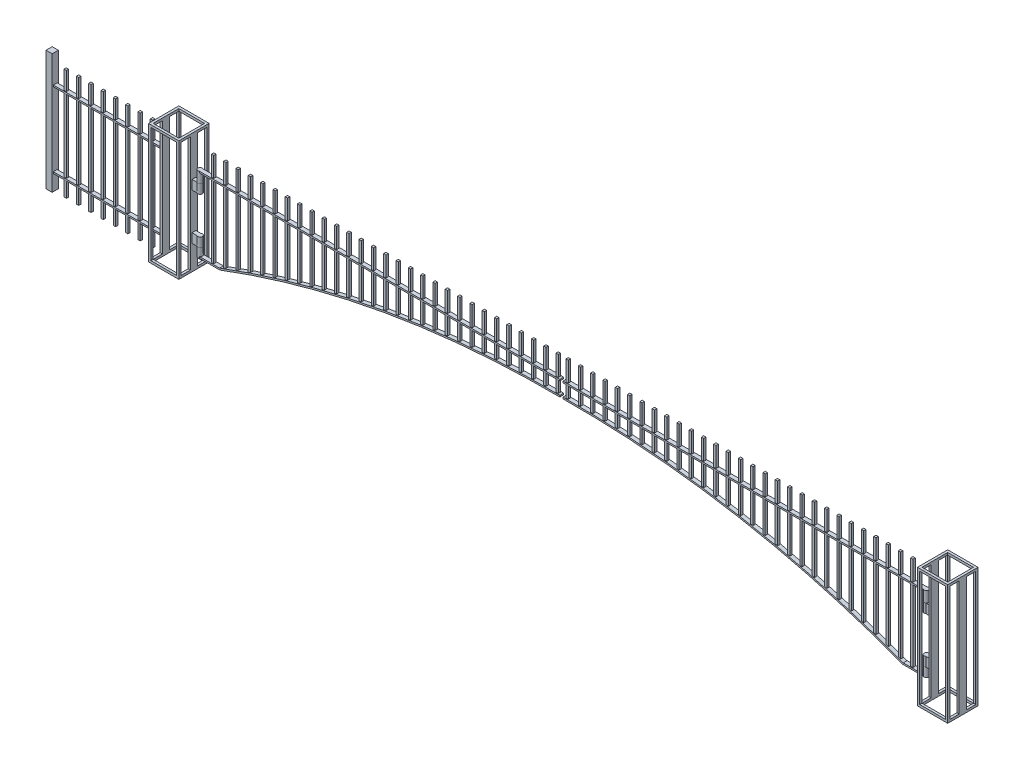
from build123d import *

# Parameters (mm, degrees)
SKETCH1_W                 = 19.05
SKETCH1_H                 = 60
BOSS_EXTRUDE1_DEPTH       = 990.6
SKETCH1_H_2               = 19.05
BOSS_EXTRUDE1_2_DEPTH     = 990.6
BOSS_EXTRUDE1_3_DEPTH     = 990.6
BOSS_EXTRUDE1_4_DEPTH     = 990.6
BOSS_EXTRUDE1_5_DEPTH     = 990.6
BOSS_EXTRUDE1_6_DEPTH     = 990.6
SKETCH1_W_2               = 50.8
SKETCH1_H_3               = 50.8
BOSS_EXTRUDE1_7_DEPTH     = 990.6
BOSS_EXTRUDE2_START       = 971.55
BOSS_EXTRUDE2_OUTLINE_W   = 211.9
BOSS_EXTRUDE2_OUTLINE_H   = 19.05
BOSS_EXTRUDE2_OUTLINE_W_2 = 19.05
BOSS_EXTRUDE2_OUTLINE_H_2 = 75.95
BOSS_EXTRUDE2_DEPTH       = 19.05
SKETCH1_4_W               = 19.05
SKETCH1_4_H               = 75.95
SKETCH1_4_W_2             = 211.9
SKETCH1_4_H_2             = 19.05
BOSS_EXTRUDE3_DEPTH       = 19.05
SKETCH1_5_W               = 19.05
SKETCH1_5_H               = 19.05
BOSS_EXTRUDE4_DEPTH       = 914.4
BOSS_EXTRUDE4_2_DEPTH     = 914.4
BOSS_EXTRUDE4_3_DEPTH     = 914.4
BOSS_EXTRUDE4_4_DEPTH     = 914.4
BOSS_EXTRUDE4_5_DEPTH     = 914.4
BOSS_EXTRUDE4_6_DEPTH     = 914.4
BOSS_EXTRUDE4_7_DEPTH     = 914.4
BOSS_EXTRUDE4_8_DEPTH     = 914.4
BOSS_EXTRUDE5_START       = 130
SKETCH2_W                 = 895.35
SKETCH2_H                 = 31.75
BOSS_EXTRUDE5_DEPTH       = 12.7
BOSS_EXTRUDE6_START       = 750
SKETCH2_2_W               = 895.35
SKETCH2_2_H               = 31.75
BOSS_EXTRUDE6_DEPTH       = 12.7
BOSS_EXTRUDE7_START       = -406.4
BOSS_EXTRUDE7_DEPTH       = 76.2
BOSS_EXTRUDE11_START      = -787.4
BOSS_EXTRUDE11_DEPTH      = 76.2
BOSS_EXTRUDE8_START       = -330.2
SKETCH5_3_R               = 19.05
BOSS_EXTRUDE8_DEPTH       = 76.2
BOSS_EXTRUDE12_START      = -787.4
SKETCH5_7_R               = 19.05
BOSS_EXTRUDE12_DEPTH      = 76.2
BOSS_EXTRUDE9_START       = -254
SKETCH5_4_W               = 19.05
SKETCH5_4_H               = 19.05
BOSS_EXTRUDE9_DEPTH       = 12.7
EXTRUDE_THIN1_START       = -15.875
EXTRUDE_THIN1_DEPTH       = 31.75
BOSS_EXTRUDE10_START      = -76.2
SKETCH5_5_W               = 19.05
SKETCH5_5_H               = 19.05
BOSS_EXTRUDE10_DEPTH      = 914.4
CUT_EXTRUDE1_DEPTH        = 4361.014057603
CUT_EXTRUDE1_DEPTH_BACK   = 4361.014057603


# Read off the part's stored shape, not the designer's step: Boss-Extrude2, Extrude-Thin1
with BuildPart() as part:
    # Sketch1 → Boss-Extrude1 (new body)
    with BuildSketch(Plane(origin=(0, 0, 0), x_dir=(1, 0, 0), z_dir=(0, 1, 0))):
        with Locations((-3288.475, 0)):
            Rectangle(SKETCH1_W, SKETCH1_H)
    extrude(amount=BOSS_EXTRUDE1_DEPTH)



with BuildPart() as body_2:
    # Sketch1 → Boss-Extrude1 2 (new body)
    with BuildSketch(Plane(origin=(0, 0, 0), x_dir=(1, 0, 0), z_dir=(0, 1, 0))):
        with Locations((-3288.475, 115.475)):
            Rectangle(SKETCH1_W, SKETCH1_H_2)
    extrude(amount=BOSS_EXTRUDE1_2_DEPTH)


with BuildPart() as body_3:
    # Sketch1 → Boss-Extrude1 3 (new body)
    with BuildSketch(Plane(origin=(0, 0, 0), x_dir=(1, 0, 0), z_dir=(0, 1, 0))):
        with Locations((-3288.475, -115.475)):
            Rectangle(SKETCH1_W, SKETCH1_H_2)
    extrude(amount=BOSS_EXTRUDE1_3_DEPTH)


with BuildPart() as body_4:
    # Sketch1 → Boss-Extrude1 4 (new body)
    with BuildSketch(Plane(origin=(0, 0, 0), x_dir=(1, 0, 0), z_dir=(0, 1, 0))):
        with Locations((-3057.525, 115.475)):
            Rectangle(SKETCH1_W, SKETCH1_H_2)
    extrude(amount=BOSS_EXTRUDE1_4_DEPTH)


with BuildPart() as body_5:
    # Sketch1 → Boss-Extrude1 5 (new body)
    with BuildSketch(Plane(origin=(0, 0, 0), x_dir=(1, 0, 0), z_dir=(0, 1, 0))):
        with Locations((-3057.525, 0)):
            Rectangle(SKETCH1_W, SKETCH1_H)
    extrude(amount=BOSS_EXTRUDE1_5_DEPTH)


with BuildPart() as body_6:
    # Sketch1 → Boss-Extrude1 6 (new body)
    with BuildSketch(Plane(origin=(0, 0, 0), x_dir=(1, 0, 0), z_dir=(0, 1, 0))):
        with Locations((-3057.525, -115.475)):
            Rectangle(SKETCH1_W, SKETCH1_H_2)
    extrude(amount=BOSS_EXTRUDE1_6_DEPTH)


with BuildPart() as body_7:
    # Sketch1 → Boss-Extrude1 7 (new body)
    with BuildSketch(Plane(origin=(0, 0, 0), x_dir=(1, 0, 0), z_dir=(0, 1, 0))):
        with Locations((-4218.75, 0)):
            Rectangle(SKETCH1_W_2, SKETCH1_H_3)
    extrude(amount=BOSS_EXTRUDE1_7_DEPTH)


with BuildPart() as part_1:
    add(part.part)

    add(body_2.part)  # Boss-Extrude2 merges body 2

    add(body_3.part)  # Boss-Extrude2 merges body 3

    add(body_4.part)  # Boss-Extrude2 merges body 4

    add(body_5.part)  # Boss-Extrude2 merges body 5

    add(body_6.part)  # Boss-Extrude2 merges body 6
    # Boss-Extrude2 outline → Boss-Extrude2 (add)
    with BuildSketch(Plane(origin=(0, 0, 0), x_dir=(1, 0, 0), z_dir=(0, 1, 0)).offset(BOSS_EXTRUDE2_START)):
        with Locations((-3173, 115.475)):
            Rectangle(BOSS_EXTRUDE2_OUTLINE_W, BOSS_EXTRUDE2_OUTLINE_H)
        with Locations((-3288.475, 67.975)):
            Rectangle(BOSS_EXTRUDE2_OUTLINE_W_2, BOSS_EXTRUDE2_OUTLINE_H_2)
        with Locations((-3057.525, 67.975)):
            Rectangle(BOSS_EXTRUDE2_OUTLINE_W_2, BOSS_EXTRUDE2_OUTLINE_H_2)
        with Locations((-3288.475, -67.975)):
            Rectangle(BOSS_EXTRUDE2_OUTLINE_W_2, BOSS_EXTRUDE2_OUTLINE_H_2)
        with Locations((-3057.525, -67.975)):
            Rectangle(BOSS_EXTRUDE2_OUTLINE_W_2, BOSS_EXTRUDE2_OUTLINE_H_2)
        with Locations((-3173, -115.475)):
            Rectangle(BOSS_EXTRUDE2_OUTLINE_W, BOSS_EXTRUDE2_OUTLINE_H)
    extrude(amount=BOSS_EXTRUDE2_DEPTH)

    # Sketch1<4> → Boss-Extrude3 (add)
    with BuildSketch(Plane(origin=(0, 0, 0), x_dir=(1, 0, 0), z_dir=(0, 1, 0))):
        with Locations((-3288.475, 67.975)):
            Rectangle(SKETCH1_4_W, SKETCH1_4_H)
        with Locations((-3288.475, -67.975)):
            Rectangle(SKETCH1_4_W, SKETCH1_4_H)
        with Locations((-3173, 115.475)):
            Rectangle(SKETCH1_4_W_2, SKETCH1_4_H_2)
        with Locations((-3057.525, 67.975)):
            Rectangle(SKETCH1_4_W, SKETCH1_4_H)
        with Locations((-3173, -115.475)):
            Rectangle(SKETCH1_4_W_2, SKETCH1_4_H_2)
        with Locations((-3057.525, -67.975)):
            Rectangle(SKETCH1_4_W, SKETCH1_4_H)
    extrude(amount=BOSS_EXTRUDE3_DEPTH)

    # Sketch5 → Boss-Extrude7 (add)
    with BuildSketch(Plane(origin=(0, 990.6, 0), x_dir=(1, 0, 0), z_dir=(0, 1, 0)).offset(BOSS_EXTRUDE7_START)):
        with BuildLine():
            Line((-3007.730283709, 15.875), (-3048, 15.875))
            Line((-3048, 15.875), (-3048, -15.875))
            Line((-3048, -15.875), (-3007.730283709, -15.875))
            ThreePointArc((-3007.730283709, -15.875), (-2978.15, 0), (-3007.730283709, 15.875))
        make_face()
    extrude(amount=BOSS_EXTRUDE7_DEPTH)

    # Sketch5<6> → Boss-Extrude11 (add)
    with BuildSketch(Plane(origin=(0, 990.6, 0), x_dir=(1, 0, 0), z_dir=(0, 1, 0)).offset(BOSS_EXTRUDE11_START)):
        with BuildLine():
            Line((-3007.730283709, 15.875), (-3048, 15.875))
            Line((-3048, 15.875), (-3048, -15.875))
            Line((-3048, -15.875), (-3007.730283709, -15.875))
            ThreePointArc((-3007.730283709, -15.875), (-2978.15, 0), (-3007.730283709, 15.875))
        make_face()
    extrude(amount=BOSS_EXTRUDE11_DEPTH)


with BuildPart() as body_3_2:
    # Sketch1<5> → Boss-Extrude4 (new body)
    with BuildSketch(Plane(origin=(0, 0, 0), x_dir=(1, 0, 0), z_dir=(0, 1, 0))):
        with Locations((-3491.675, 0)):
            Rectangle(SKETCH1_5_W, SKETCH1_5_H)
    extrude(amount=BOSS_EXTRUDE4_DEPTH)


with BuildPart() as body_4_2:
    # Sketch1<5> → Boss-Extrude4 2 (new body)
    with BuildSketch(Plane(origin=(0, 0, 0), x_dir=(1, 0, 0), z_dir=(0, 1, 0))):
        with Locations((-3390.075, 0)):
            Rectangle(SKETCH1_5_W, SKETCH1_5_H)
    extrude(amount=BOSS_EXTRUDE4_2_DEPTH)


    add(body_3_2.part)  # Boss-Extrude5 merges body 3 2


with BuildPart() as body_5_2:
    # Sketch1<5> → Boss-Extrude4 3 (new body)
    with BuildSketch(Plane(origin=(0, 0, 0), x_dir=(1, 0, 0), z_dir=(0, 1, 0))):
        with Locations((-3593.275, 0)):
            Rectangle(SKETCH1_5_W, SKETCH1_5_H)
    extrude(amount=BOSS_EXTRUDE4_3_DEPTH)


with BuildPart() as body_6_2:
    # Sketch1<5> → Boss-Extrude4 4 (new body)
    with BuildSketch(Plane(origin=(0, 0, 0), x_dir=(1, 0, 0), z_dir=(0, 1, 0))):
        with Locations((-3694.875, 0)):
            Rectangle(SKETCH1_5_W, SKETCH1_5_H)
    extrude(amount=BOSS_EXTRUDE4_4_DEPTH)


with BuildPart() as body_7_2:
    # Sketch1<5> → Boss-Extrude4 5 (new body)
    with BuildSketch(Plane(origin=(0, 0, 0), x_dir=(1, 0, 0), z_dir=(0, 1, 0))):
        with Locations((-3796.475, 0)):
            Rectangle(SKETCH1_5_W, SKETCH1_5_H)
    extrude(amount=BOSS_EXTRUDE4_5_DEPTH)


with BuildPart() as body_8:
    # Sketch1<5> → Boss-Extrude4 6 (new body)
    with BuildSketch(Plane(origin=(0, 0, 0), x_dir=(1, 0, 0), z_dir=(0, 1, 0))):
        with Locations((-3898.075, 0)):
            Rectangle(SKETCH1_5_W, SKETCH1_5_H)
    extrude(amount=BOSS_EXTRUDE4_6_DEPTH)


with BuildPart() as body_9:
    # Sketch1<5> → Boss-Extrude4 7 (new body)
    with BuildSketch(Plane(origin=(0, 0, 0), x_dir=(1, 0, 0), z_dir=(0, 1, 0))):
        with Locations((-3999.675, 0)):
            Rectangle(SKETCH1_5_W, SKETCH1_5_H)
    extrude(amount=BOSS_EXTRUDE4_7_DEPTH)


with BuildPart() as body_10:
    # Sketch1<5> → Boss-Extrude4 8 (new body)
    with BuildSketch(Plane(origin=(0, 0, 0), x_dir=(1, 0, 0), z_dir=(0, 1, 0))):
        with Locations((-4101.275, 0)):
            Rectangle(SKETCH1_5_W, SKETCH1_5_H)
    extrude(amount=BOSS_EXTRUDE4_8_DEPTH)


with BuildPart() as body_4_2_1:
    add(body_4_2.part)

    add(body_5_2.part)  # Boss-Extrude5 merges body 5 2

    add(body_6_2.part)  # Boss-Extrude5 merges body 6 2

    add(body_7_2.part)  # Boss-Extrude5 merges body 7 2

    add(body_8.part)  # Boss-Extrude5 merges body 8

    add(body_9.part)  # Boss-Extrude5 merges body 9

    add(body_10.part)  # Boss-Extrude5 merges body 10

    add(body_7.part)  # Boss-Extrude5 merges body 7
    # Sketch2 → Boss-Extrude5 (add)
    with BuildSketch(Plane(origin=(0, 0, 0), x_dir=(1, 0, 0), z_dir=(0, 1, 0)).offset(BOSS_EXTRUDE5_START)):
        with Locations((-3745.675, 0)):
            Rectangle(SKETCH2_W, SKETCH2_H)
    extrude(amount=BOSS_EXTRUDE5_DEPTH)

    # Sketch2<2> → Boss-Extrude6 (add)
    with BuildSketch(Plane(origin=(0, 0, 0), x_dir=(1, 0, 0), z_dir=(0, 1, 0)).offset(BOSS_EXTRUDE6_START)):
        with Locations((-3745.675, 0)):
            Rectangle(SKETCH2_2_W, SKETCH2_2_H)
    extrude(amount=BOSS_EXTRUDE6_DEPTH)


with BuildPart() as body_3_3:
    # Sketch5<3> → Boss-Extrude8 (new body)
    with BuildSketch(Plane(origin=(0, 990.6, 0), x_dir=(1, 0, 0), z_dir=(0, 1, 0)).offset(BOSS_EXTRUDE8_START)):
        with Locations(Location((-2997.2, 0, 0), (0, 0, 90))):
            Circle(SKETCH5_3_R)
    extrude(amount=BOSS_EXTRUDE8_DEPTH)

    # Sketch5<4> → Boss-Extrude9 (add)
    with BuildSketch(Plane(origin=(0, 990.6, 0), x_dir=(1, 0, 0), z_dir=(0, 1, 0)).offset(BOSS_EXTRUDE9_START)):
        with BuildLine():
            ThreePointArc((-2986.669716291, 15.875), (-3016.25, 0), (-2986.669716291, -15.875))
            Line((-2986.669716291, -15.875), (-12.7, -15.875))
            Line((-12.7, -15.875), (-12.7, 15.875))
            Line((-12.7, 15.875), (-2986.669716291, 15.875))
        make_face()
        with Locations((-41.275, 0)):
            Rectangle(SKETCH5_4_W, SKETCH5_4_H, mode=Mode.SUBTRACT)
        with Locations((-2886.075, 0)):
            Rectangle(SKETCH5_4_W, SKETCH5_4_H, mode=Mode.SUBTRACT)
        with Locations((-2784.475, 0)):
            Rectangle(SKETCH5_4_W, SKETCH5_4_H, mode=Mode.SUBTRACT)
        with Locations((-2682.875, 0)):
            Rectangle(SKETCH5_4_W, SKETCH5_4_H, mode=Mode.SUBTRACT)
        with Locations((-2581.275, 0)):
            Rectangle(SKETCH5_4_W, SKETCH5_4_H, mode=Mode.SUBTRACT)
        with Locations((-2479.675, 0)):
            Rectangle(SKETCH5_4_W, SKETCH5_4_H, mode=Mode.SUBTRACT)
        with Locations((-2378.075, 0)):
            Rectangle(SKETCH5_4_W, SKETCH5_4_H, mode=Mode.SUBTRACT)
        with Locations((-2276.475, 0)):
            Rectangle(SKETCH5_4_W, SKETCH5_4_H, mode=Mode.SUBTRACT)
        with Locations((-2174.875, 0)):
            Rectangle(SKETCH5_4_W, SKETCH5_4_H, mode=Mode.SUBTRACT)
        with Locations((-2073.275, 0)):
            Rectangle(SKETCH5_4_W, SKETCH5_4_H, mode=Mode.SUBTRACT)
        with Locations((-1971.675, 0)):
            Rectangle(SKETCH5_4_W, SKETCH5_4_H, mode=Mode.SUBTRACT)
        with Locations((-1870.075, 0)):
            Rectangle(SKETCH5_4_W, SKETCH5_4_H, mode=Mode.SUBTRACT)
        with Locations((-1768.475, 0)):
            Rectangle(SKETCH5_4_W, SKETCH5_4_H, mode=Mode.SUBTRACT)
        with Locations((-1666.875, 0)):
            Rectangle(SKETCH5_4_W, SKETCH5_4_H, mode=Mode.SUBTRACT)
        with Locations((-1565.275, 0)):
            Rectangle(SKETCH5_4_W, SKETCH5_4_H, mode=Mode.SUBTRACT)
        with Locations((-1463.675, 0)):
            Rectangle(SKETCH5_4_W, SKETCH5_4_H, mode=Mode.SUBTRACT)
        with Locations((-1362.075, 0)):
            Rectangle(SKETCH5_4_W, SKETCH5_4_H, mode=Mode.SUBTRACT)
        with Locations((-1260.475, 0)):
            Rectangle(SKETCH5_4_W, SKETCH5_4_H, mode=Mode.SUBTRACT)
        with Locations((-1158.875, 0)):
            Rectangle(SKETCH5_4_W, SKETCH5_4_H, mode=Mode.SUBTRACT)
        with Locations((-1057.275, 0)):
            Rectangle(SKETCH5_4_W, SKETCH5_4_H, mode=Mode.SUBTRACT)
        with Locations((-955.675, 0)):
            Rectangle(SKETCH5_4_W, SKETCH5_4_H, mode=Mode.SUBTRACT)
        with Locations((-854.075, 0)):
            Rectangle(SKETCH5_4_W, SKETCH5_4_H, mode=Mode.SUBTRACT)
        with Locations((-752.475, 0)):
            Rectangle(SKETCH5_4_W, SKETCH5_4_H, mode=Mode.SUBTRACT)
        with Locations((-650.875, 0)):
            Rectangle(SKETCH5_4_W, SKETCH5_4_H, mode=Mode.SUBTRACT)
        with Locations((-549.275, 0)):
            Rectangle(SKETCH5_4_W, SKETCH5_4_H, mode=Mode.SUBTRACT)
        with Locations((-447.675, 0)):
            Rectangle(SKETCH5_4_W, SKETCH5_4_H, mode=Mode.SUBTRACT)
        with Locations((-346.075, 0)):
            Rectangle(SKETCH5_4_W, SKETCH5_4_H, mode=Mode.SUBTRACT)
        with Locations((-244.475, 0)):
            Rectangle(SKETCH5_4_W, SKETCH5_4_H, mode=Mode.SUBTRACT)
        with Locations((-142.875, 0)):
            Rectangle(SKETCH5_4_W, SKETCH5_4_H, mode=Mode.SUBTRACT)
    extrude(amount=BOSS_EXTRUDE9_DEPTH)



with BuildPart() as body_4_3:
    # Sketch5<7> → Boss-Extrude12 (new body)
    with BuildSketch(Plane(origin=(0, 990.6, 0), x_dir=(1, 0, 0), z_dir=(0, 1, 0)).offset(BOSS_EXTRUDE12_START)):
        with Locations(Location((-2997.2, 0, 0), (0, 0, 90))):
            Circle(SKETCH5_7_R)
    extrude(amount=-BOSS_EXTRUDE12_DEPTH)

    # Extrude-Thin1 outline → Extrude-Thin1 (add)
    with BuildSketch(Plane.XY.offset(EXTRUDE_THIN1_START)):
        with BuildLine():
            Line((-2988, 127), (-2819.4, 127))
            add(Edge.make_bspline(
                [(-2819.4, 127), (-1473.440102285, 635.310682922), (-12.7, 622.3)],
                knots=[0, 0, 0, 1, 1, 1], degree=2))
            Line((-12.7, 622.3), (-12.58688671, 634.999496265))
            add(Edge.make_bspline(
                [(-2821.717245495, 139.7), (-2372.667601337, 309.134996515), (-1914.022815578, 435.135459322), (-977.619173426, 600.237772857), (-499.861687645, 639.339609829), (-12.58688671, 634.999496265)],
                knots=[0, 0, 0, 0, 0.5, 0.5, 1, 1, 1, 1], degree=3))
            Line((-2821.717245495, 139.7), (-2988, 139.7))
            Line((-2988, 139.7), (-2988, 127))
        make_face()
    extrude(amount=EXTRUDE_THIN1_DEPTH)


with BuildPart() as body_3_3_1:
    add(body_3_3.part)

    add(body_4_3.part)  # Boss-Extrude10 merges body 4 3
    # Sketch5<5> → Boss-Extrude10 (add)
    with BuildSketch(Plane(origin=(0, 990.6, 0), x_dir=(1, 0, 0), z_dir=(0, 1, 0)).offset(BOSS_EXTRUDE10_START)):
        with Locations((-1463.675, 0)):
            Rectangle(SKETCH5_5_W, SKETCH5_5_H)
        with Locations((-1057.275, 0)):
            Rectangle(SKETCH5_5_W, SKETCH5_5_H)
        with Locations((-955.675, 0)):
            Rectangle(SKETCH5_5_W, SKETCH5_5_H)
        with Locations((-854.075, 0)):
            Rectangle(SKETCH5_5_W, SKETCH5_5_H)
        with Locations((-752.475, 0)):
            Rectangle(SKETCH5_5_W, SKETCH5_5_H)
        with Locations((-650.875, 0)):
            Rectangle(SKETCH5_5_W, SKETCH5_5_H)
        with Locations((-549.275, 0)):
            Rectangle(SKETCH5_5_W, SKETCH5_5_H)
        with Locations((-447.675, 0)):
            Rectangle(SKETCH5_5_W, SKETCH5_5_H)
        with Locations((-346.075, 0)):
            Rectangle(SKETCH5_5_W, SKETCH5_5_H)
        with Locations((-244.475, 0)):
            Rectangle(SKETCH5_5_W, SKETCH5_5_H)
        with Locations((-142.875, 0)):
            Rectangle(SKETCH5_5_W, SKETCH5_5_H)
        with Locations((-2886.075, 0)):
            Rectangle(SKETCH5_5_W, SKETCH5_5_H)
        with Locations((-2784.475, 0)):
            Rectangle(SKETCH5_5_W, SKETCH5_5_H)
        with Locations((-2682.875, 0)):
            Rectangle(SKETCH5_5_W, SKETCH5_5_H)
        with Locations((-2581.275, 0)):
            Rectangle(SKETCH5_5_W, SKETCH5_5_H)
        with Locations((-2479.675, 0)):
            Rectangle(SKETCH5_5_W, SKETCH5_5_H)
        with Locations((-2378.075, 0)):
            Rectangle(SKETCH5_5_W, SKETCH5_5_H)
        with Locations((-2276.475, 0)):
            Rectangle(SKETCH5_5_W, SKETCH5_5_H)
        with Locations((-2174.875, 0)):
            Rectangle(SKETCH5_5_W, SKETCH5_5_H)
        with Locations((-2073.275, 0)):
            Rectangle(SKETCH5_5_W, SKETCH5_5_H)
        with Locations((-1971.675, 0)):
            Rectangle(SKETCH5_5_W, SKETCH5_5_H)
        with Locations((-1870.075, 0)):
            Rectangle(SKETCH5_5_W, SKETCH5_5_H)
        with Locations((-1768.475, 0)):
            Rectangle(SKETCH5_5_W, SKETCH5_5_H)
        with Locations((-1666.875, 0)):
            Rectangle(SKETCH5_5_W, SKETCH5_5_H)
        with Locations((-1565.275, 0)):
            Rectangle(SKETCH5_5_W, SKETCH5_5_H)
        with Locations((-1362.075, 0)):
            Rectangle(SKETCH5_5_W, SKETCH5_5_H)
        with Locations((-1260.475, 0)):
            Rectangle(SKETCH5_5_W, SKETCH5_5_H)
        with Locations((-1158.875, 0)):
            Rectangle(SKETCH5_5_W, SKETCH5_5_H)
        with Locations((-41.275, 0)):
            Rectangle(SKETCH5_5_W, SKETCH5_5_H)
    extrude(amount=-BOSS_EXTRUDE10_DEPTH)

    # Sketch6<3> → Cut-Extrude1 (cut, two sides: drawn at the far end of the back side and taken through both)
    with BuildSketch(Plane.XY.offset(-CUT_EXTRUDE1_DEPTH_BACK)):
        with BuildLine():
            add(Edge.make_bspline(
                [(-2819.4, 127), (-1473.440102285, 635.310682922), (-12.7, 622.3)],
                knots=[0, 0, 0, 1, 1, 1], degree=2))
            Line((-12.7, 622.3), (0, -557.715822447))
            Line((0, -557.715822447), (-2997.2, -181.386379714))
            Line((-2997.2, -181.386379714), (-2997.2, 127))
            Line((-2997.2, 127), (-2819.4, 127))
        make_face()
    extrude(amount=CUT_EXTRUDE1_DEPTH + CUT_EXTRUDE1_DEPTH_BACK, mode=Mode.SUBTRACT)


with BuildPart() as body_4_4:
    # Mirror1: mirrored copy
    add(body_3_3_1.part.mirror(Plane(origin=(0, 0, 0), x_dir=(0, 0, 1), z_dir=(1, 0, 0))))


with BuildPart() as body_5_3:
    # Mirror1 2: mirrored copy
    add(part_1.part.mirror(Plane(origin=(0, 0, 0), x_dir=(0, 0, 1), z_dir=(1, 0, 0))))


solid = Compound([part_1.part, body_4_2_1.part, body_3_3_1.part, body_4_4.part, body_5_3.part])
